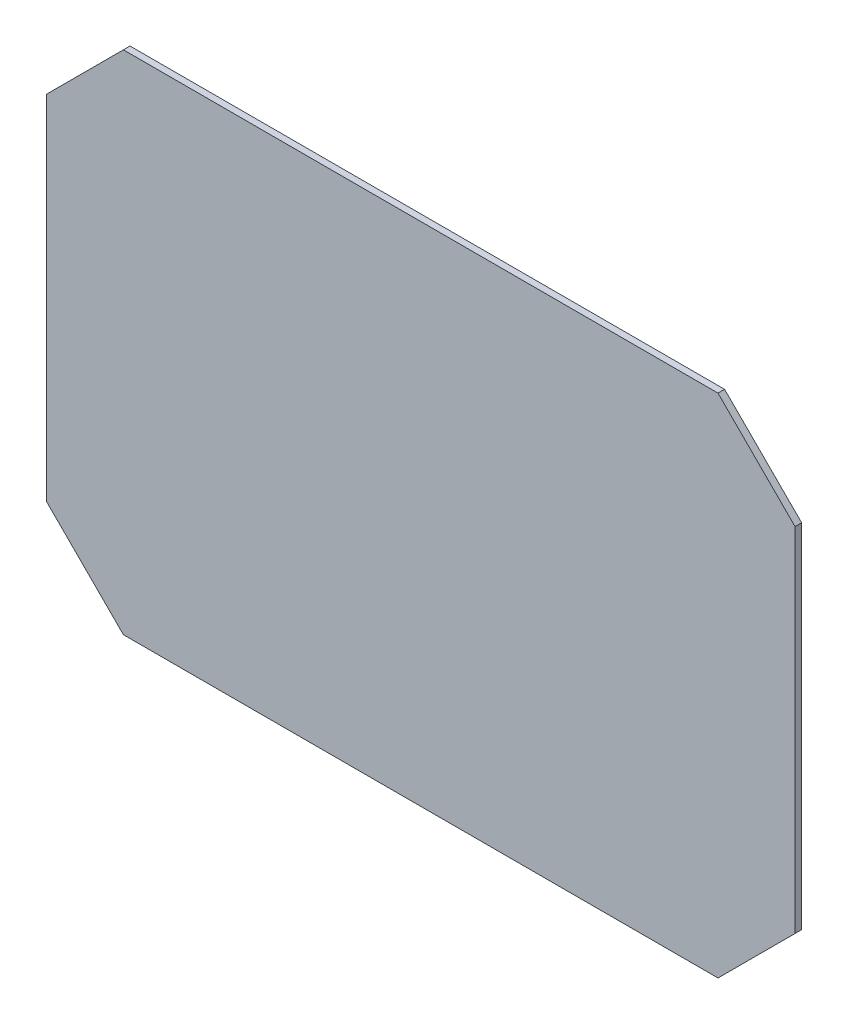
from build123d import *

# Parameters (mm, degrees)
SKETCH1_W           = 340
SKETCH1_H           = 230
BOSS_EXTRUDE1_DEPTH = 3
CHAMFER2_SIZE       = 35


with BuildPart() as part:
    # Sketch1 → Boss-Extrude1 (new body)
    with BuildSketch(Plane.XY):
        Rectangle(SKETCH1_W, SKETCH1_H)
    extrude(amount=BOSS_EXTRUDE1_DEPTH)

    # Chamfer2
    chamfer2_edges = [part.edges().sort_by_distance(p)[0] for p in [
        (170, -115, 1.5),
        (170, 115, 1.5),
        (-170, -115, 1.5),
        (-170, 115, 1.5),
    ]]
    chamfer(chamfer2_edges, length=CHAMFER2_SIZE)


solid = part.part
